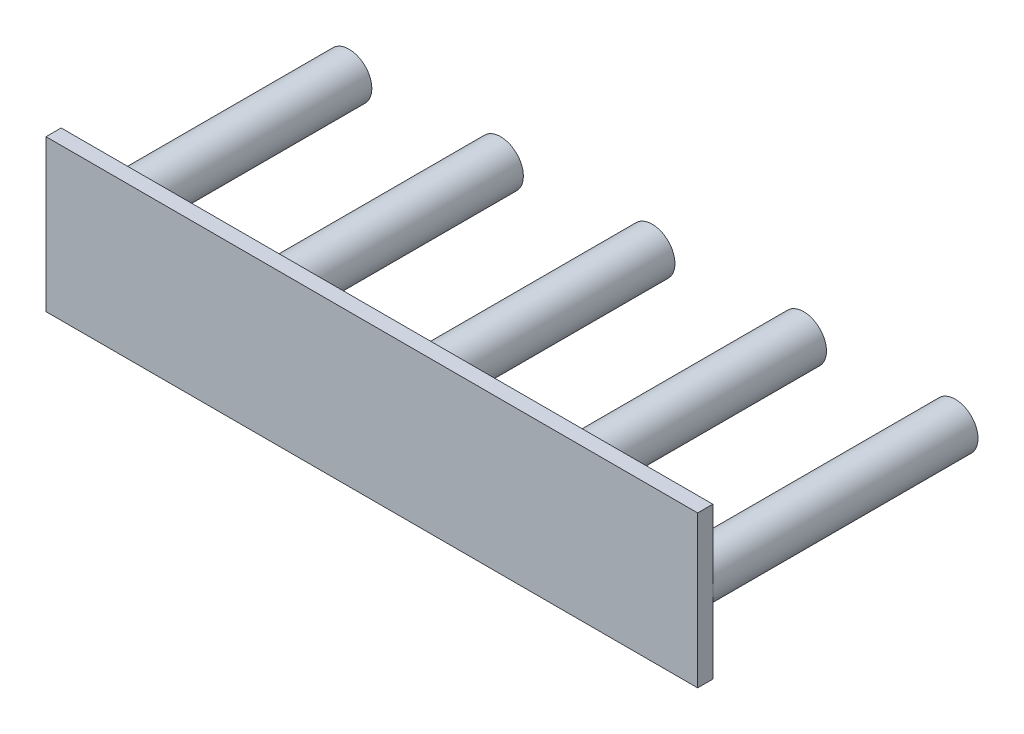
from build123d import *

# Parameters (mm, degrees)
ESQUISSE1_R                = 3
ESQUISSE1_R_2              = 1.5
BOSS_EXTRU_1_DEPTH         = 35
R_P_TITION_LIN_AIRE1_COUNT = 5
R_P_TITION_LIN_AIRE1_PITCH = 20
ESQUISSE2_W                = 86
ESQUISSE2_H                = 20
BOSS_EXTRU_2_DEPTH         = 2


with BuildPart() as part:
    # Esquisse1 → Boss.-Extru.1 (new body)
    with BuildSketch(Plane.XY):
        Circle(ESQUISSE1_R)
        Circle(ESQUISSE1_R_2, mode=Mode.SUBTRACT)
    extrude(amount=BOSS_EXTRU_1_DEPTH)


with BuildPart() as r_p_tition_lin_aire1_1:
    # Répétition linéaire1: pattern copy
    add(part.part.moved(Location(Vector(-1, 0, 0) * (1 * R_P_TITION_LIN_AIRE1_PITCH))))


with BuildPart() as r_p_tition_lin_aire1_2:
    # Répétition linéaire1: pattern copy
    add(part.part.moved(Location(Vector(-1, 0, 0) * (2 * R_P_TITION_LIN_AIRE1_PITCH))))


with BuildPart() as r_p_tition_lin_aire1_3:
    # Répétition linéaire1: pattern copy
    add(part.part.moved(Location(Vector(-1, 0, 0) * (3 * R_P_TITION_LIN_AIRE1_PITCH))))


with BuildPart() as r_p_tition_lin_aire1_4:
    # Répétition linéaire1: pattern copy
    add(part.part.moved(Location(Vector(-1, 0, 0) * (4 * R_P_TITION_LIN_AIRE1_PITCH))))


with BuildPart() as part_1:
    add(part.part)

    add(r_p_tition_lin_aire1_1.part)  # Boss.-Extru.2 merges Répétition linéaire1_1

    add(r_p_tition_lin_aire1_2.part)  # Boss.-Extru.2 merges Répétition linéaire1_2

    add(r_p_tition_lin_aire1_3.part)  # Boss.-Extru.2 merges Répétition linéaire1_3

    add(r_p_tition_lin_aire1_4.part)  # Boss.-Extru.2 merges Répétition linéaire1_4
    # Esquisse2 → Boss.-Extru.2 (add)
    with BuildSketch(Plane.XY.offset(35)):
        with Locations((-40, 0)):
            Rectangle(ESQUISSE2_W, ESQUISSE2_H)
    extrude(amount=BOSS_EXTRU_2_DEPTH)


solid = part_1.part
